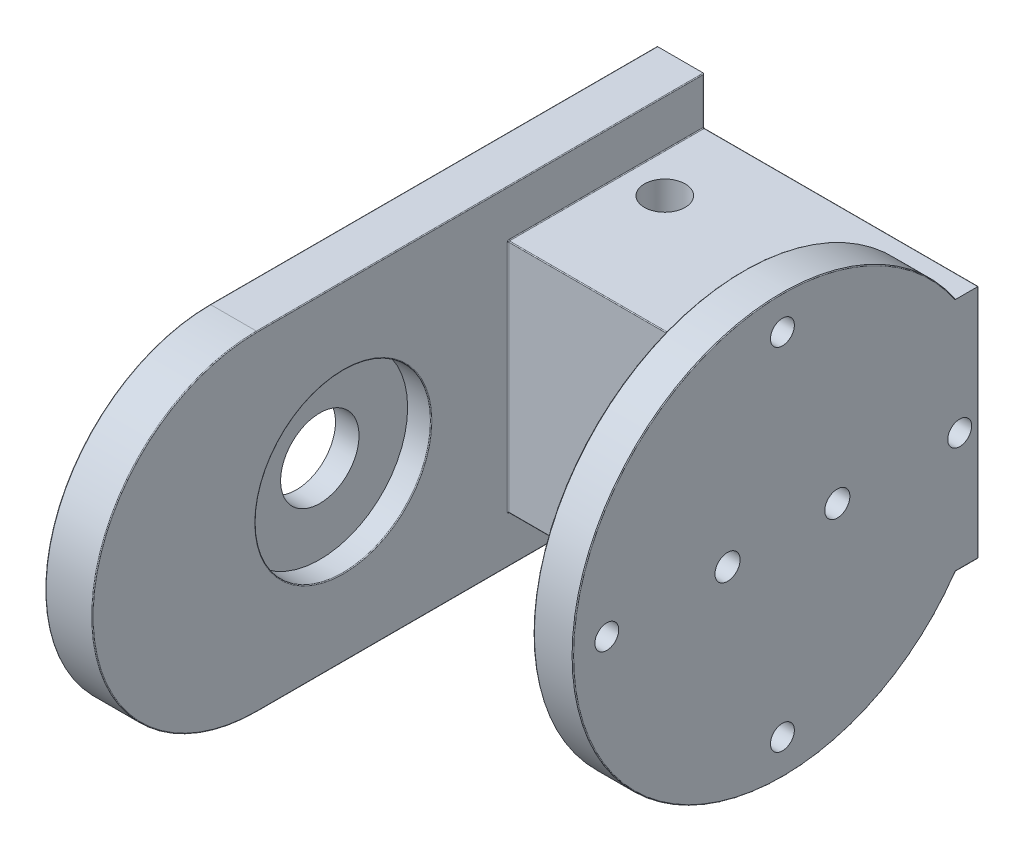
from build123d import *

# Parameters (mm, degrees)
BOSS_EXTRUDE1_DEPTH = 6.000000983
SKETCH2_W           = 24.999999441
SKETCH2_H           = 29.999998398
BOSS_EXTRUDE2_DEPTH = 29.999997467
SKETCH3_W           = 19.999999553
SKETCH3_H           = 19.999999553
CUT_EXTRUDE1_DEPTH  = 81.149858764
SKETCH14_R          = 11.2
CUT_EXTRUDE12_DEPTH = 3
SKETCH15_R          = 2.6
CUT_EXTRUDE13_DEPTH = 102.435737903
SKETCH19_R          = 2.6
CUT_EXTRUDE15_DEPTH = 102.00598463
SKETCH22_R          = 5
CUT_EXTRUDE16_DEPTH = 10
SKETCH23_R          = 26.727135434
BOSS_EXTRUDE3_DEPTH = 5
CUT_EXTRUDE17_DEPTH = 10
SKETCH25_R          = 1.6
CUT_EXTRUDE18_DEPTH = 10
BOSS_EXTRUDE4_START = -2.916592192
BOSS_EXTRUDE4_DEPTH = 2.916592192
SKETCH27_W          = 3.882504998
SKETCH27_H          = 30.149410972
CUT_EXTRUDE19_DEPTH = 5
FILLET4_R           = 0.1


with BuildPart() as part:
    # Sketch1 → Boss-Extrude1 (new body)
    with BuildSketch(Plane(origin=(45.028056949, 0, 0), x_dir=(0, 0, -1), z_dir=(1, 0, 0))):
        with BuildLine():
            Line((-37.000000447, 0), (19.999999553, 0))
            Line((19.999999553, 0), (19.999999553, 41.999999434))
            Line((19.999999553, 41.999999434), (-37.000000447, 41.999999434))
            ThreePointArc((-37.000000447, 41.999999434), (-58.000000164, 20.999999717), (-37.000000447, 0))
        make_face()
    extrude(amount=-BOSS_EXTRUDE1_DEPTH)

    # Sketch2 → Boss-Extrude2 (add)
    with BuildSketch(Plane(origin=(45.028056949, 0, 0), x_dir=(0, 0, -1), z_dir=(1, 0, 0))):
        with Locations((7.499999833, 20.999999251)):
            Rectangle(SKETCH2_W, SKETCH2_H)
    extrude(amount=BOSS_EXTRUDE2_DEPTH)

    # Sketch3 → Cut-Extrude1 (cut, through all)
    with BuildSketch(Plane.ZY.offset(-39.028055966)):
        with Locations((-9.999999777, 20.999999716)):
            Rectangle(SKETCH3_W, SKETCH3_H)
    extrude(amount=-CUT_EXTRUDE1_DEPTH, mode=Mode.SUBTRACT)

    # Sketch14 → Cut-Extrude12 (cut)
    with BuildSketch(Plane(origin=(45.028056949, 0, 0), x_dir=(0, 0, -1), z_dir=(1, 0, 0))):
        with Locations((-25.999999888, 20.999999717)):
            Circle(SKETCH14_R)
    extrude(amount=-CUT_EXTRUDE12_DEPTH, mode=Mode.SUBTRACT)

    # Sketch15 → Cut-Extrude13 (cut, through all)
    with BuildSketch(Plane(origin=(0, 6.000000052, 0), x_dir=(-1, 0, 0), z_dir=(0, -1, 0))):
        with Locations(Location((-50.028056949, 9.999999553, 0), (0, 0, 90))):
            Circle(SKETCH15_R)
        with Locations(Location((-70.028056949, 9.999999553, 0), (0, 0, 90))):
            Circle(SKETCH15_R)
    extrude(amount=-CUT_EXTRUDE13_DEPTH, mode=Mode.SUBTRACT)

    # Sketch19 → Cut-Extrude15 (cut, through all)
    with BuildSketch(Plane.XY.offset(4.999999888)):
        with Locations((60.028055683, 20.999999251)):
            Circle(SKETCH19_R)
    extrude(amount=-CUT_EXTRUDE15_DEPTH, mode=Mode.SUBTRACT)

    # Sketch22 → Cut-Extrude16 (cut)
    with BuildSketch(Plane(origin=(42.028056949, 0, 0), x_dir=(0, 0, -1), z_dir=(1, 0, 0))):
        with Locations((-25.999999888, 20.999999717)):
            Circle(SKETCH22_R)
    extrude(amount=-CUT_EXTRUDE16_DEPTH, mode=Mode.SUBTRACT)

    # Sketch23 → Boss-Extrude3 (add)
    with BuildSketch(Plane(origin=(75.028054416, 0, 0), x_dir=(0, 0, -1), z_dir=(1, 0, 0))):
        with Locations(Location((-4.999999888, 20.999999251, 0), (0, 0, 325.859280765))):
            Circle(SKETCH23_R)
    extrude(amount=BOSS_EXTRUDE3_DEPTH)

    # Sketch24 → Cut-Extrude17 (cut)
    with BuildSketch(Plane(origin=(80.028054416, 0, 0), x_dir=(0, 0, -1), z_dir=(1, 0, 0))):
        with BuildLine():
            ThreePointArc((-3.957021029, 44.546252652), (-4.999999888, 44.959050105), (-6.042978747, 44.546252652))
            ThreePointArc((-6.042978747, 44.546252652), (-4.999999888, 41.911050105), (-3.957021029, 44.546252652))
        make_face()
        with BuildLine():
            ThreePointArc((-5.860673651, -2.55362244), (-4.999999888, -2.819919504), (-4.139326126, -2.55362244))
            ThreePointArc((-4.139326126, -2.55362244), (-4.999999888, 0.228080496), (-5.860673651, -2.55362244))
        make_face()
        with BuildLine():
            ThreePointArc((18.538374705, 19.79220141), (19.132966089, 20.999999251), (18.538374705, 22.207797092))
            ThreePointArc((18.538374705, 22.207797092), (16.084966089, 20.999999251), (18.538374705, 19.79220141))
        make_face()
        with BuildLine():
            ThreePointArc((-28.548005764, 22.002632473), (-28.924267718, 20.999999251), (-28.548005764, 19.99736603))
            ThreePointArc((-28.548005764, 19.99736603), (-25.876267718, 20.999999251), (-28.548005764, 22.002632473))
        make_face()
    extrude(amount=-CUT_EXTRUDE17_DEPTH, mode=Mode.SUBTRACT)

    # Sketch25 → Cut-Extrude18 (cut)
    with BuildSketch(Plane(origin=(80.028054416, 0, 0), x_dir=(0, 0, -1), z_dir=(1, 0, 0))):
        with Locations((-11.999999888, 20.999999251)):
            Circle(SKETCH25_R)
        with Locations((2.000000112, 20.999999251)):
            Circle(SKETCH25_R)
    extrude(amount=-CUT_EXTRUDE18_DEPTH, mode=Mode.SUBTRACT)

    # Boss-Extrude4: read off the stored shape, not the designer's step
    # Boss-Extrude4 outline → Boss-Extrude4 (add)
    with BuildSketch(Plane(origin=(0, 0, -19.999999553), x_dir=(-1, 0, 0), z_dir=(0, 0, -1)).offset(BOSS_EXTRUDE4_START)):
        Polygon((-75.028054416, 30.451972401), (-75.028054416, 30.999999493), (-39.028055966, 30.999999493), (-39.028055966, 41.999999434), (-45.028056949, 41.999999434), (-45.028056949, 35.99999845), (-80.028054416, 35.99999845), (-80.028054416, 30.451972401), align=None)
        Polygon((-39.028055966, 0), (-39.028055966, 10.99999994), (-75.028054416, 10.99999994), (-75.028054416, 11.548026102), (-80.028054416, 11.548026102), (-80.028054416, 5.944671532), (-75.028054416, 5.944671532), (-75.028054416, 6.000000052), (-45.028056949, 6.000000052), (-45.028056949, 0), align=None)
    extrude(amount=BOSS_EXTRUDE4_DEPTH)

    # Sketch27 → Cut-Extrude19 (cut)
    with BuildSketch(Plane(origin=(80.028054416, 0, 0), x_dir=(0, 0, -1), z_dir=(1, 0, 0))):
        with Locations((21.941252052, 20.925292964)):
            Rectangle(SKETCH27_W, SKETCH27_H)
    extrude(amount=-CUT_EXTRUDE19_DEPTH, mode=Mode.SUBTRACT)

    # Fillet4
    fillet4_edges = [part.edges().sort_by_distance(p)[0] for p in [
        (39.028055966, 0, 8.500000447),
        (42.028056458, 0, -19.999999553),
        (45.028056949, 0, 8.500000447),
        (45.028056949, 20.999999717, 58.000000164),
        (39.028055966, 20.999999717, 58.000000164),
        (39.028055966, 41.999999434, 8.500000447),
        (39.028055966, 5.49999997, -19.999999553),
        (39.028055966, 10.99999994, -9.999999776),
        (39.028055966, 20.999999717, 0),
        (39.028055966, 30.999999493, -9.999999776),
        (39.028055966, 36.499999464, -19.999999553),
        (45.028056949, 3.000000026, -19.999999553),
        (57.028055191, 10.99999994, -19.999999553),
        (75.028054416, 11.274013021, -19.999999553),
        (75.028054416, 20.999999252, -19.999999553),
        (75.028054416, 30.725985947, -19.999999553),
        (57.028055191, 30.999999493, -19.999999553),
        (45.028056949, 38.999998942, -19.999999553),
        (60.028055683, 35.99999845, -19.999999553),
        (77.528054416, 35.99999845, -19.999999553),
        (80.028054416, 33.225985425, -19.999999553),
        (80.028054416, 20.999999252, -19.999999553),
        (80.028054416, 8.746348817, -19.999999553),
        (60.028055683, 6.000000052, -19.999999553),
        (45.028056949, 6.000000052, -7.499999832),
        (45.028056949, 20.999999251, 4.999999888),
        (45.028056949, 35.99999845, -7.499999832),
        (45.028056949, 41.999999434, 8.500000447),
        (45.028056949, 20.999999717, 37.199999888),
        (60.028055683, 6.000000052, 4.999999888),
        (60.028055683, 35.99999845, 4.999999888),
        (75.028054416, 21.033452269, 31.727114386),
        (80.028054416, 5.944671532, -18.541703457),
        (80.028054416, 21.033452269, 31.727114386),
    ]]
    fillet(fillet4_edges, radius=FILLET4_R)


solid = part.part
